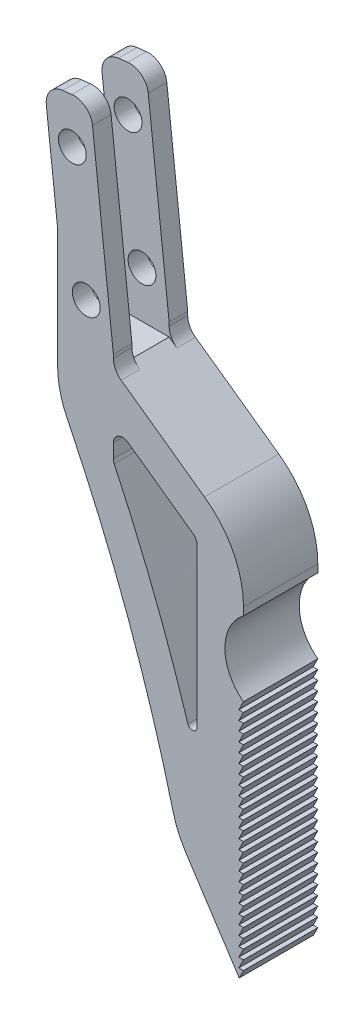
from build123d import *

# Parameters (mm, degrees)
BOSS_EXTRUDE1_DEPTH     = 4
SKETCH2_W               = 20
SKETCH2_H               = 25
CUT_EXTRUDE1_DEPTH      = 2
CUT_EXTRUDE2_DEPTH      = 78.699873386
CUT_EXTRUDE2_DEPTH_BACK = 78.699873386
CUT_EXTRUDE3_DEPTH      = 78.699873386
LPATTERN3_START         = -4
LPATTERN3_DEPTH         = 8
CUT_EXTRUDE4_DEPTH      = 78.699873386
CUT_EXTRUDE5_DEPTH      = 78.699873386
FILLET1_R               = 10
FILLET2_R               = 2
FILLET3_R               = 1
FILLET4_R               = 0.5
SKETCH7_R               = 1.5
CUT_EXTRUDE6_DEPTH      = 78.443079806


# Read off the part's stored shape, not the designer's step: LPattern3
with BuildPart() as part:
    # Sketch1 → Boss-Extrude1 (new, symmetric)
    with BuildSketch(Plane.XY):
        Polygon((0, 0), (-20, 30.652242985), (-20, 60.782242985), (-21.435566599, 73.70273634), (-16.466146078, 74.25487734), (-14.000284373, 52.061445292), (-14.000284373, 50.661445292), (0, 40.6751395), align=None)
    extrude(amount=BOSS_EXTRUDE1_DEPTH, both=True)

    # Sketch2 → Cut-Extrude1 (cut, symmetric)
    with BuildSketch(Plane.XY):
        with Locations((-24.000284373, 63.161445292)):
            Rectangle(SKETCH2_W, SKETCH2_H)
    extrude(amount=CUT_EXTRUDE1_DEPTH, both=True, mode=Mode.SUBTRACT)

    # Sketch3 → Cut-Extrude2 (cut, two sides: drawn at the far end of the back side and taken through both)
    with BuildSketch(Plane.XY.offset(4).offset(-CUT_EXTRUDE2_DEPTH_BACK)):
        with BuildLine():
            Line((91.496624596, 103.297607947), (0, 34.6751395))
            ThreePointArc((0, 34.6751395), (-2, 30.6751395), (0, 26.6751395))
            Line((0, 26.6751395), (91.496624596, -41.947328947))
            Line((91.496624596, -41.947328947), (320.238186086, -41.947328947))
            Line((320.238186086, -41.947328947), (320.238186086, 103.297607947))
            Line((320.238186086, 103.297607947), (91.496624596, 103.297607947))
        make_face()
    extrude(amount=CUT_EXTRUDE2_DEPTH + CUT_EXTRUDE2_DEPTH_BACK, mode=Mode.SUBTRACT)

    # Sketch4 → Cut-Extrude3 (cut, symmetric)
    with BuildSketch(Plane.XY.offset(4)):
        Polygon((0, 26.6751395), (-0.5, 25.6751395), (0, 25.6751395), align=None)
    extrude(amount=CUT_EXTRUDE3_DEPTH, both=True, mode=Mode.SUBTRACT)

    # LPattern3 outline → LPattern3 (cut)
    with BuildSketch(Plane.XY.offset(LPATTERN3_START)):
        Polygon((0, 0), (0, 1.6126395), (-0.456500581, 0.699638337), align=None)
        Polygon((-0.5, 24.6726395), (0, 24.6726395), (0, 25.6726395), align=None)
        Polygon((-0.5, 23.6701395), (0, 23.6701395), (0, 24.6701395), align=None)
        Polygon((-0.5, 22.6676395), (0, 22.6676395), (0, 23.6676395), align=None)
        Polygon((-0.5, 21.6651395), (0, 21.6651395), (0, 22.6651395), align=None)
        Polygon((-0.5, 20.6626395), (0, 20.6626395), (0, 21.6626395), align=None)
        Polygon((-0.5, 19.6601395), (0, 19.6601395), (0, 20.6601395), align=None)
        Polygon((-0.5, 18.6576395), (0, 18.6576395), (0, 19.6576395), align=None)
        Polygon((-0.5, 17.6551395), (0, 17.6551395), (0, 18.6551395), align=None)
        Polygon((-0.5, 16.6526395), (0, 16.6526395), (0, 17.6526395), align=None)
        Polygon((-0.5, 15.6501395), (0, 15.6501395), (0, 16.6501395), align=None)
        Polygon((-0.5, 14.6476395), (0, 14.6476395), (0, 15.6476395), align=None)
        Polygon((-0.5, 13.6451395), (0, 13.6451395), (0, 14.6451395), align=None)
        Polygon((-0.5, 12.6426395), (0, 12.6426395), (0, 13.6426395), align=None)
        Polygon((-0.5, 11.6401395), (0, 11.6401395), (0, 12.6401395), align=None)
        Polygon((-0.5, 10.6376395), (0, 10.6376395), (0, 11.6376395), align=None)
        Polygon((-0.5, 9.6351395), (0, 9.6351395), (0, 10.6351395), align=None)
        Polygon((-0.5, 8.6326395), (0, 8.6326395), (0, 9.6326395), align=None)
        Polygon((-0.5, 7.6301395), (0, 7.6301395), (0, 8.6301395), align=None)
        Polygon((-0.5, 6.6276395), (0, 6.6276395), (0, 7.6276395), align=None)
        Polygon((-0.5, 5.6251395), (0, 5.6251395), (0, 6.6251395), align=None)
        Polygon((-0.5, 4.6226395), (0, 4.6226395), (0, 5.6226395), align=None)
        Polygon((-0.5, 3.6201395), (0, 3.6201395), (0, 4.6201395), align=None)
        Polygon((-0.5, 2.6176395), (0, 2.6176395), (0, 3.6176395), align=None)
        Polygon((-0.5, 1.6151395), (0, 1.6151395), (0, 2.6151395), align=None)
    extrude(amount=LPATTERN3_DEPTH, mode=Mode.SUBTRACT)

    # Sketch5 → Cut-Extrude4 (cut, through all)
    with BuildSketch(Plane.XY.offset(4)):
        with BuildLine():
            Line((-20, 45.652242985), (-20, 30.652242985))
            Line((-20, 30.652242985), (-7.147540984, 10.954408149))
            ThreePointArc((-7.147540984, 10.954408149), (-12.567364929, 28.676109238), (-20, 45.652242985))
        make_face()
    extrude(amount=-CUT_EXTRUDE4_DEPTH, mode=Mode.SUBTRACT)

    # Sketch6 → Cut-Extrude5 (cut, through all)
    with BuildSketch(Plane.XY.offset(4)):
        with BuildLine():
            Line((-14.004117633, 45.750871885), (-5, 39.328297195))
            Line((-5, 39.328297195), (-5, 18.390871885))
            ThreePointArc((-5, 18.390871885), (-9.031897039, 30.419496018), (-14.004117633, 42.090871885))
            Line((-14.004117633, 42.090871885), (-14.004117633, 45.750871885))
        make_face()
    extrude(amount=-CUT_EXTRUDE5_DEPTH, mode=Mode.SUBTRACT)

    # Fillet1
    fillet1_edges = [part.edges().sort_by_distance(p)[0] for p in [
        (-20, 45.652242985, 0),
        (-7.147540984, 10.954408149, 0),
        (0, 40.6751395, 0),
    ]]
    fillet(fillet1_edges, radius=FILLET1_R)

    # Fillet2
    fillet2_edges = [part.edges().sort_by_distance(p)[0] for p in [
        (-14.000284373, 50.661445292, -3),
        (-16.466146078, 74.25487734, -3),
        (-21.435566599, 73.70273634, -3),
        (-14.000284373, 50.661445292, 3),
        (-16.466146078, 74.25487734, 3),
        (-21.435566599, 73.70273634, 3),
    ]]
    fillet(fillet2_edges, radius=FILLET2_R)

    # Fillet3
    fillet3_edges = [part.edges().sort_by_distance(p)[0] for p in [
        (-14.004117633, 42.090871885, 0),
        (-14.004117633, 45.750871885, 0),
        (-5, 39.328297195, 0),
    ]]
    fillet(fillet3_edges, radius=FILLET3_R)

    # Fillet4
    fillet4_edges = [part.edges().sort_by_distance(p)[0] for p in [
        (-5, 18.390871885, 0),
    ]]
    fillet(fillet4_edges, radius=FILLET4_R)

    # Sketch7 → Cut-Extrude6 (cut, through all)
    with BuildSketch(Plane.XY.offset(4)):
        with Locations((-18.416383851, 69.168407775)):
            Circle(SKETCH7_R)
        with Locations((-16.915664614, 55.661522799)):
            Circle(SKETCH7_R)
    extrude(amount=-CUT_EXTRUDE6_DEPTH, mode=Mode.SUBTRACT)


solid = part.part
